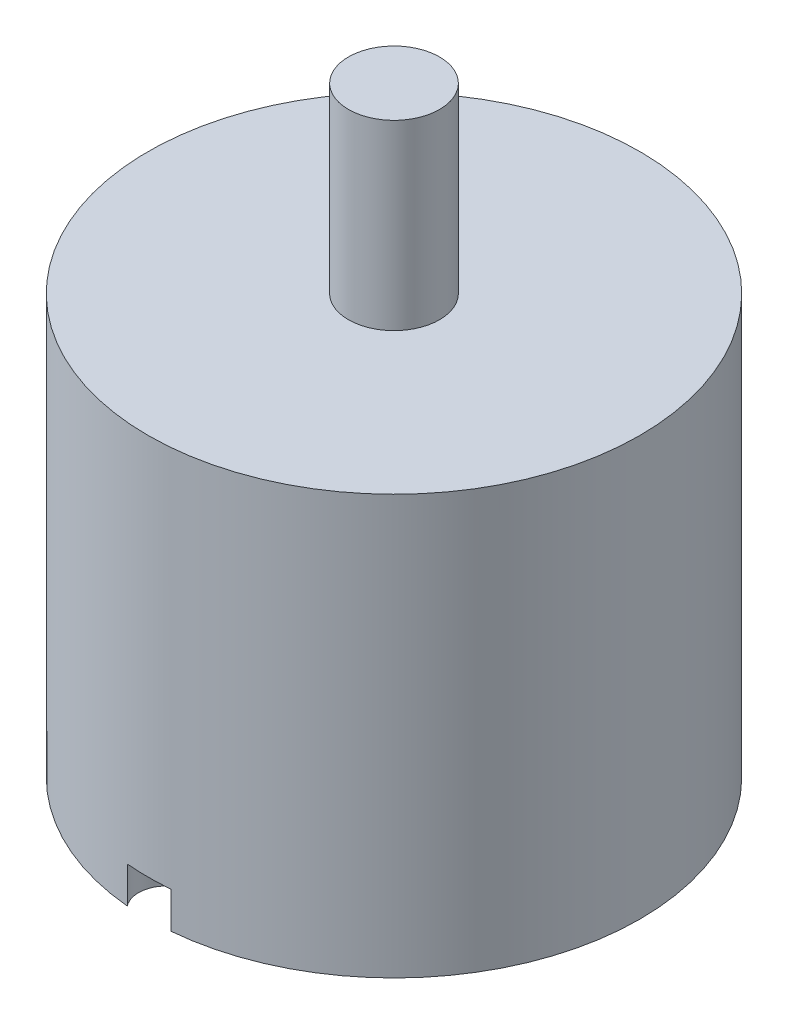
from build123d import *

# Parameters (mm, degrees)
SKETCH1_R           = 13.499973
BOSS_EXTRUDE1_DEPTH = 23.0000048
SKETCH2_R           = 2.5
BOSS_EXTRUDE2_DEPTH = 10
SKETCH3_R           = 1.499997
BOSS_EXTRUDE3_DEPTH = 2
SKETCH4_R           = 1.524
SKETCH4_R_2         = 1.5
CUT_EXTRUDE1_DEPTH  = 2


with BuildPart() as part:
    # Sketch1 → Boss-Extrude1 (new body)
    with BuildSketch(Plane(origin=(0, 0, 0), x_dir=(1, 0, 0), z_dir=(0, 1, 0))):
        Circle(SKETCH1_R)
    extrude(amount=BOSS_EXTRUDE1_DEPTH)

    # Sketch2 → Boss-Extrude2 (add)
    with BuildSketch(Plane(origin=(0, 23.0000048, 0), x_dir=(1, 0, 0), z_dir=(0, 1, 0))):
        Circle(SKETCH2_R)
    extrude(amount=BOSS_EXTRUDE2_DEPTH)

    # Sketch3 → Boss-Extrude3 (add)
    with BuildSketch(Plane.XZ):
        Circle(SKETCH3_R)
    extrude(amount=BOSS_EXTRUDE3_DEPTH)

    # Sketch4 → Cut-Extrude1 (cut)
    with BuildSketch(Plane.XZ):
        with Locations((0, 12.5000004)):
            Circle(SKETCH4_R)
        with Locations((9.4999937, 0)):
            Circle(SKETCH4_R_2)
        with Locations((-9.4999937, 0)):
            Circle(SKETCH4_R_2)
        with Locations((0, -12.5000004)):
            Circle(SKETCH4_R)
    extrude(amount=-CUT_EXTRUDE1_DEPTH, mode=Mode.SUBTRACT)


solid = part.part
